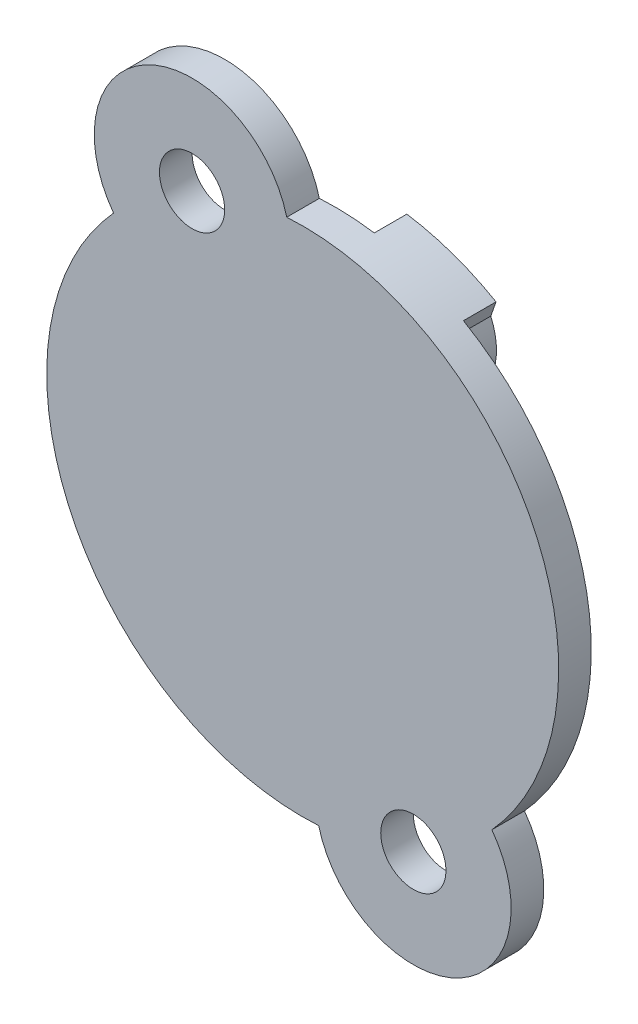
from build123d import *
from build123d.topology import SkipClean

# Parameters (mm, degrees)
SKETCH1_R           = 7.85
BOSS_EXTRUDE1_DEPTH = 1
BOSS_EXTRUDE2_START = 1
SKETCH3_R           = 4.5
BOSS_EXTRUDE2_DEPTH = 1
BOSS_EXTRUDE3_DEPTH = 1
SKETCH2_3_R         = 1
CUT_EXTRUDE1_DEPTH  = 2
SKETCH2_4_R         = 1
CUT_EXTRUDE2_DEPTH  = 3


with BuildPart() as part:
    # Sketch1 → Boss-Extrude1 (new body)
    with BuildSketch(Plane.XY):
        Circle(SKETCH1_R)
    extrude(amount=BOSS_EXTRUDE1_DEPTH)

    # Sketch3 → Boss-Extrude2 (add)
    with SkipClean():  # the faces are left unmerged after this step: merging them gives an invalid solid
        with BuildSketch(Plane(origin=(0, 0, 0), x_dir=(-1, 0, 0), z_dir=(0, 0, -1)).offset(BOSS_EXTRUDE2_START)):
            with BuildLine():
                Line((-3.929330982, 6.795797086), (-3.767491551, 6.336026426))
                ThreePointArc((-3.767491551, 6.336026426), (-3.9423428, 5.505849389), (-3.757317387, 4.677880508))
                ThreePointArc((-3.757317387, 4.677880508), (-5.659611173, -1.992185075), (0.001300165, -5.999999859))
                ThreePointArc((0.001300165, -5.999999859), (0.375700996, -6.761308528), (1.032012818, -7.298915878))
                Line((1.032012818, -7.298915878), (1.193852248, -7.758686539))
                ThreePointArc((1.193852248, -7.758686539), (2.606442139, -7.404657951), (3.929330982, -6.795797086))
                Line((3.929330982, -6.795797086), (3.767491551, -6.336026426))
                ThreePointArc((3.767491551, -6.336026426), (3.9423428, -5.505849389), (3.757317387, -4.677880508))
                ThreePointArc((3.757317387, -4.677880508), (5.659611173, 1.992185075), (-0.001300165, 5.999999859))
                ThreePointArc((-0.001300165, 5.999999859), (-0.375700996, 6.761308528), (-1.032012818, 7.298915878))
                Line((-1.032012818, 7.298915878), (-1.193852248, 7.758686539))
                ThreePointArc((-1.193852248, 7.758686539), (-2.606442139, 7.404657951), (-3.929330982, 6.795797086))
            make_face()
            Circle(SKETCH3_R, mode=Mode.SUBTRACT)
        extrude(amount=-BOSS_EXTRUDE2_DEPTH)

    # Sketch2 → Boss-Extrude3 (add)
    with BuildSketch(Plane(origin=(0, 0, 0), x_dir=(-1, 0, 0), z_dir=(0, 0, -1))):
        with BuildLine():
            ThreePointArc((2.46537987, 7.452811691), (3.825061249, 7.980689597), (4.265263368, 6.590146311))
            ThreePointArc((4.265263368, 6.590146311), (5.074768612, 5.989092046), (5.800557161, 5.289237811))
            ThreePointArc((5.800557161, 5.289237811), (4.68948187, 9.784235269), (0.489616971, 7.834716027))
            ThreePointArc((0.489616971, 7.834716027), (1.489786667, 7.707336485), (2.46537987, 7.452811691))
        make_face()
        with BuildLine():
            ThreePointArc((-4.265263368, -6.590146311), (-5.074768612, -5.989092046), (-5.800557161, -5.289237811))
            ThreePointArc((-5.800557161, -5.289237811), (-4.68948187, -9.784235269), (-0.489616971, -7.834716027))
            ThreePointArc((-0.489616971, -7.834716027), (-1.489786667, -7.707336485), (-2.46537987, -7.452811691))
            ThreePointArc((-2.46537987, -7.452811691), (-3.825061249, -7.980689597), (-4.265263368, -6.590146311))
        make_face()
    extrude(amount=-BOSS_EXTRUDE3_DEPTH)

    # Sketch2<3> → Cut-Extrude1 (cut)
    with BuildSketch(Plane(origin=(0, 0, 0), x_dir=(-1, 0, 0), z_dir=(0, 0, -1))):
        with Locations((3.392850938, 7.078916761)):
            Circle(SKETCH2_3_R)
    extrude(amount=-CUT_EXTRUDE1_DEPTH, mode=Mode.SUBTRACT)

    # Sketch2<4> → Cut-Extrude2 (cut)
    with BuildSketch(Plane(origin=(0, 0, 0), x_dir=(-1, 0, 0), z_dir=(0, 0, -1))):
        with Locations((-3.392850938, -7.078916761)):
            Circle(SKETCH2_4_R)
    extrude(amount=-CUT_EXTRUDE2_DEPTH, mode=Mode.SUBTRACT)


solid = part.part
